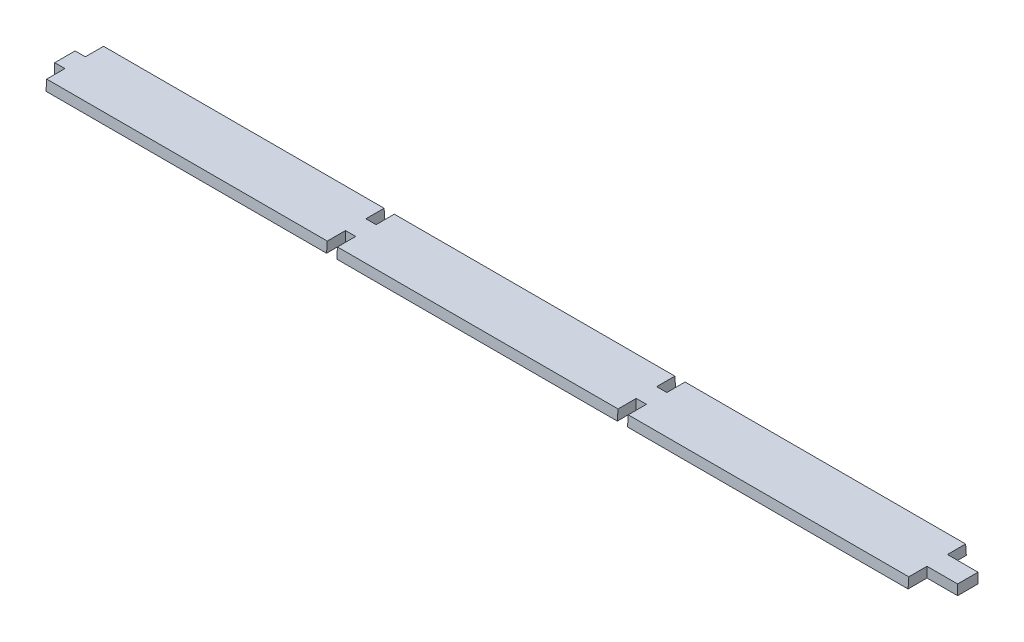
from build123d import *

# Parameters (mm, degrees)
EXTRUDE_1_DEPTH     = 2
EXTRUDE_START       = -173
EXTRUDE_3_DEPTH     = 171
CUT_EXTRUDE_START   = -173
CUT_EXTRUDE_2_DEPTH = 173
CUT_EXTRUDE_3_DEPTH = 173
SKETCH_4_W          = 2
SKETCH_4_H          = 6.981331277
SKETCH_4_H_2        = 7.769959708
CUT_EXTRUDE_4_DEPTH = 173
SKETCH_5_W          = 4
SKETCH_5_H          = 4
EXTRUDE_4_DEPTH     = 2


# Read off the part's stored shape, not the designer's step: 凸台-拉伸3, 切除-拉伸2
with BuildPart() as part:
    # 草图1 → 凸台-拉伸1 (new body)
    with BuildSketch(Plane(origin=(0, 0, 0), x_dir=(0, 0, -1), z_dir=(1, 0, 0))):
        with BuildLine():
            add(Edge.make_bspline(
                [(0, 193), (-0.012288284, 193), (-0.036860363, 192.682209119), (-0.073603598, 192.460340025), (-0.134145604, 191.982517083), (-0.216837903, 191.357126895), (-0.320148772, 190.531582795), (-0.442734222, 189.535054466), (-0.583708338, 188.359470773), (-0.741224015, 187.007350916), (-0.91342743, 185.485486569), (-1.098367032, 183.794042277), (-1.295153474, 181.932788993), (-1.503001463, 179.912860559), (-1.722142684, 177.734330299), (-1.951645546, 175.397073133), (-2.189862364, 172.914023799), (-2.436037979, 170.28517003), (-2.689763937, 167.510432908), (-2.949769263, 164.606175429), (-3.216039401, 161.572442464), (-3.488047586, 158.409161795), (-3.764070677, 155.134176566), (-4.043757612, 151.747511152), (-4.326255141, 148.249059823), (-4.609441768, 144.658859051), (-4.892481807, 140.976882583), (-5.174863501, 137.20308085), (-5.454691966, 133.359174667), (-5.731636208, 129.445182711), (-6.004663443, 125.461027301), (-6.271447257, 121.429287101), (-6.531172087, 117.349948117), (-6.782917884, 113.222962102), (-7.024648371, 109.072183193), (-7.255701434, 104.897612739), (-7.474940032, 100.699220215), (-7.679991999, 96.500812992), (-7.870083896, 92.302403851), (-8.044216273, 88.103993125), (-8.200659206, 83.929344542), (-8.338917914, 79.778489584), (-8.457541038, 75.651485195), (-8.538807898, 72.228525811), (-8.592437236, 69.509703707), (-8.626639137, 67.495423053), (-8.65491323, 65.495919754), (-8.677150684, 63.511211116), (-8.693364484, 61.541315238), (-8.703342087, 59.588985896), (-8.707094981, 57.65423498), (-8.70416559, 55.737088716), (-8.694147501, 53.840077973), (-8.676636137, 51.963218651), (-8.652114277, 50.106548117), (-8.620905719, 48.272790784), (-8.583512891, 46.461970379), (-8.539492523, 44.674120145), (-8.488374712, 42.911972119), (-8.429886653, 41.175558617), (-8.364375531, 39.464915618), (-8.291893829, 37.782113513), (-8.212897106, 36.127162371), (-8.127038802, 34.500129191), (-8.034038273, 32.903290152), (-7.933854661, 31.336686835), (-7.826611275, 29.800367448), (-7.712449105, 28.296372863), (-7.591658572, 26.824726145), (-7.4640673, 25.385515918), (-7.329411875, 23.980771462), (-7.187764067, 22.610559791), (-7.039458689, 21.274927209), (-6.884625469, 19.975944864), (-6.723768994, 18.713621105), (-6.557419856, 17.487989507), (-6.385750528, 16.300272749), (-6.209456896, 15.150457547), (-6.028620184, 14.038630129), (-5.842946286, 12.966402663), (-5.653007841, 11.933787905), (-5.458792398, 10.940905593), (-5.259967948, 9.989173646), (-5.057199181, 9.078608267), (-4.84951644, 8.209636835), (-4.635268995, 7.382464783), (-4.414704057, 6.597361178), (-4.187298343, 5.854834196), (-3.951488141, 5.1553355), (-3.708306212, 4.499219664), (-3.457504838, 3.88735236), (-3.196526443, 3.319048044), (-2.927146299, 2.794798361), (-2.650818291, 2.315014682), (-2.367000425, 1.880667992), (-2.0794803, 1.491615537), (-1.792593552, 1.14703863), (-1.50916051, 0.848541142), (-1.234038339, 0.5935698), (-0.966592418, 0.382804324), (-0.705813073, 0.218534665), (-0.459755647, 0.097332853), (-0.234428055, 0.020960156), (0, -0.01036), (0.234428055, 0.020960156), (0.459755647, 0.097332853), (0.705813073, 0.218534665), (0.966592418, 0.382804324), (1.234038339, 0.5935698), (1.50916051, 0.848541142), (1.792593552, 1.14703863), (2.0794803, 1.491615537), (2.367000425, 1.880667992), (2.650818291, 2.315014682), (2.927146299, 2.794798361), (3.196526443, 3.319048044), (3.457504838, 3.88735236), (3.708306212, 4.499219664), (3.951488141, 5.1553355), (4.187298343, 5.854834196), (4.414704057, 6.597361178), (4.635268995, 7.382464783), (4.84951644, 8.209636835), (5.057199181, 9.078608267), (5.259967948, 9.989173646), (5.458792398, 10.940905593), (5.653007841, 11.933787905), (5.842946286, 12.966402663), (6.028620184, 14.038630129), (6.209456896, 15.150457547), (6.385750528, 16.300272749), (6.557419856, 17.487989507), (6.723768994, 18.713621105), (6.884625469, 19.975944864), (7.039458689, 21.274927209), (7.187764067, 22.610559791), (7.329411875, 23.980771462), (7.4640673, 25.385515918), (7.591658572, 26.824726145), (7.712449105, 28.296372863), (7.826611275, 29.800367448), (7.933854661, 31.336686835), (8.034038273, 32.903290152), (8.127038802, 34.500129191), (8.212897106, 36.127162371), (8.291893829, 37.782113513), (8.364375531, 39.464915618), (8.429886653, 41.175558617), (8.488374712, 42.911972119), (8.539492523, 44.674120145), (8.583512891, 46.461970379), (8.620905719, 48.272790784), (8.652114277, 50.106548117), (8.676636137, 51.963218651), (8.694147501, 53.840077973), (8.70416559, 55.737088716), (8.707094981, 57.65423498), (8.703342087, 59.588985896), (8.693364484, 61.541315238), (8.677150684, 63.511211116), (8.65491323, 65.495919754), (8.626639137, 67.495423053), (8.592437236, 69.509703707), (8.538807898, 72.228525811), (8.457541038, 75.651485195), (8.338917914, 79.778489584), (8.200659206, 83.929344542), (8.044216273, 88.103993125), (7.870083896, 92.302403851), (7.679991999, 96.500812992), (7.474940032, 100.699220215), (7.255701434, 104.897612739), (7.024648371, 109.072183193), (6.782917884, 113.222962102), (6.531172087, 117.349948117), (6.271447257, 121.429287101), (6.004663443, 125.461027301), (5.731636208, 129.445182711), (5.454691966, 133.359174667), (5.174863501, 137.20308085), (4.892481807, 140.976882583), (4.609441768, 144.658859051), (4.326255141, 148.249059823), (4.043757612, 151.747511152), (3.764070677, 155.134176566), (3.488047586, 158.409161795), (3.216039401, 161.572442464), (2.949769263, 164.606175429), (2.689763937, 167.510432908), (2.436037979, 170.28517003), (2.189862364, 172.914023799), (1.951645546, 175.397073133), (1.722142684, 177.734330299), (1.503001463, 179.912860559), (1.295153474, 181.932788993), (1.098367032, 183.794042277), (0.91342743, 185.485486569), (0.741224015, 187.007350916), (0.583708338, 188.359470773), (0.442734222, 189.535054466), (0.320148772, 190.531582795), (0.216837903, 191.357126895), (0.134145604, 191.982517083), (0.073603598, 192.460340025), (0.036860363, 192.682209119), (0.012288284, 193), (0, 193)],
                knots=[0, 0, 0, 0, 0.000711186, 0.001422112, 0.002133252, 0.004251581, 0.006369198, 0.008487526, 0.011973078, 0.015457521, 0.018943038, 0.023734754, 0.028524887, 0.033316573, 0.039329174, 0.045339833, 0.051352399, 0.058485874, 0.06561704, 0.072750533, 0.080878992, 0.089004858, 0.097133325, 0.106119171, 0.115102078, 0.124087938, 0.133776582, 0.143462084, 0.153150736, 0.163374861, 0.173595632, 0.183819726, 0.194405238, 0.20498727, 0.215572756, 0.226336088, 0.237095883, 0.247859171, 0.25861711, 0.269371511, 0.28012949, 0.290699718, 0.301266554, 0.311836761, 0.316994414, 0.322150426, 0.327308111, 0.332351582, 0.337393397, 0.342436877, 0.347345125, 0.352251772, 0.357160037, 0.361913828, 0.366666143, 0.371419983, 0.375998605, 0.380575696, 0.385154319, 0.389537078, 0.393918407, 0.398301185, 0.402472485, 0.406642416, 0.410813696, 0.4147565, 0.418698025, 0.422640862, 0.426339932, 0.430037815, 0.433736878, 0.437177346, 0.44061666, 0.444057116, 0.447223686, 0.450389262, 0.45355583, 0.4564397, 0.459322619, 0.462206438, 0.464796512, 0.467385721, 0.469975829, 0.472263129, 0.474549689, 0.476836911, 0.478824757, 0.480812048, 0.482800105, 0.484492893, 0.486185006, 0.487877314, 0.489293868, 0.490710107, 0.49212745, 0.493276037, 0.494423523, 0.495568649, 0.496434714, 0.497302284, 0.498179926, 0.498796407, 0.499405099, 0.5, 0.500594901, 0.501203593, 0.501820074, 0.502697716, 0.503565286, 0.504431351, 0.505576477, 0.506723963, 0.50787255, 0.509289893, 0.510706132, 0.512122686, 0.513814994, 0.515507107, 0.517199895, 0.519187952, 0.521175243, 0.523163089, 0.525450311, 0.527736871, 0.530024171, 0.532614279, 0.535203488, 0.537793562, 0.540677381, 0.5435603, 0.54644417, 0.549610738, 0.552776314, 0.555942884, 0.55938334, 0.562822654, 0.566263122, 0.569962185, 0.573660068, 0.577359138, 0.581301975, 0.5852435, 0.589186304, 0.593357584, 0.597527515, 0.601698815, 0.606081593, 0.610462922, 0.614845681, 0.619424304, 0.624001395, 0.628580017, 0.633333857, 0.638086172, 0.642839963, 0.647748228, 0.652654875, 0.657563123, 0.662606603, 0.667648418, 0.672691889, 0.677849574, 0.683005586, 0.688163239, 0.698733446, 0.709300282, 0.71987051, 0.730628489, 0.74138289, 0.752140829, 0.762904117, 0.773663912, 0.784427244, 0.79501273, 0.805594762, 0.816180274, 0.826404368, 0.836625139, 0.846849264, 0.856537916, 0.866223418, 0.875912062, 0.884897922, 0.893880829, 0.902866675, 0.910995142, 0.919121008, 0.927249467, 0.93438296, 0.941514126, 0.948647601, 0.954660167, 0.960670826, 0.966683427, 0.971475113, 0.976265246, 0.981056962, 0.984542479, 0.988026922, 0.991512474, 0.993630802, 0.995748419, 0.997866748, 0.998577888, 0.999288814, 1, 1, 1, 1], degree=3))
        make_face()
    extrude(amount=EXTRUDE_1_DEPTH)

    # 凸台-拉伸3 outline → 凸台-拉伸3 (add)
    with BuildSketch(Plane(origin=(2, 0, 0), x_dir=(0, 0, -1), z_dir=(1, 0, 0)).offset(EXTRUDE_START)):
        with BuildLine():
            add(Edge.make_bspline(
                [(0, 193), (-0.012288284, 193), (-0.036860363, 192.682209119), (-0.073603598, 192.460340025), (-0.134145604, 191.982517083), (-0.216837903, 191.357126895), (-0.320148772, 190.531582795), (-0.442734222, 189.535054466), (-0.583708338, 188.359470773), (-0.741224015, 187.007350916), (-0.91342743, 185.485486569), (-1.098367032, 183.794042277), (-1.295153474, 181.932788993), (-1.503001463, 179.912860559), (-1.722142684, 177.734330299), (-1.951645546, 175.397073133), (-2.189862364, 172.914023799), (-2.436037979, 170.28517003), (-2.689763937, 167.510432908), (-2.949769263, 164.606175429), (-3.216039401, 161.572442464), (-3.488047586, 158.409161795), (-3.764070677, 155.134176566), (-4.043757612, 151.747511152), (-4.326255141, 148.249059823), (-4.609441768, 144.658859051), (-4.892481807, 140.976882583), (-5.174863501, 137.20308085), (-5.454691966, 133.359174667), (-5.731636208, 129.445182711), (-6.004663443, 125.461027301), (-6.271447257, 121.429287101), (-6.531172087, 117.349948117), (-6.782917884, 113.222962102), (-7.024648371, 109.072183193), (-7.255701434, 104.897612739), (-7.474940032, 100.699220215), (-7.679991999, 96.500812992), (-7.870083896, 92.302403851), (-8.044216273, 88.103993125), (-8.200659206, 83.929344542), (-8.338917914, 79.778489584), (-8.457541038, 75.651485195), (-8.538807898, 72.228525811), (-8.592437236, 69.509703707), (-8.626639137, 67.495423053), (-8.65491323, 65.495919754), (-8.677150684, 63.511211116), (-8.693364484, 61.541315238), (-8.703342087, 59.588985896), (-8.707094981, 57.65423498), (-8.70416559, 55.737088716), (-8.694147501, 53.840077973), (-8.676636137, 51.963218651), (-8.652114277, 50.106548117), (-8.620905719, 48.272790784), (-8.583512891, 46.461970379), (-8.539492523, 44.674120145), (-8.488374712, 42.911972119), (-8.429886653, 41.175558617), (-8.364375531, 39.464915618), (-8.291893829, 37.782113513), (-8.212897106, 36.127162371), (-8.127038802, 34.500129191), (-8.034038273, 32.903290152), (-7.933854661, 31.336686835), (-7.826611275, 29.800367448), (-7.712449105, 28.296372863), (-7.591658572, 26.824726145), (-7.4640673, 25.385515918), (-7.329411875, 23.980771462), (-7.187764067, 22.610559791), (-7.039458689, 21.274927209), (-6.884625469, 19.975944864), (-6.723768994, 18.713621105), (-6.557419856, 17.487989507), (-6.385750528, 16.300272749), (-6.209456896, 15.150457547), (-6.028620184, 14.038630129), (-5.842946286, 12.966402663), (-5.653007841, 11.933787905), (-5.458792398, 10.940905593), (-5.259967948, 9.989173646), (-5.057199181, 9.078608267), (-4.84951644, 8.209636835), (-4.635268995, 7.382464783), (-4.414704057, 6.597361178), (-4.187298343, 5.854834196), (-3.951488141, 5.1553355), (-3.708306212, 4.499219664), (-3.457504838, 3.88735236), (-3.196526443, 3.319048044), (-2.927146299, 2.794798361), (-2.650818291, 2.315014682), (-2.367000425, 1.880667992), (-2.0794803, 1.491615537), (-1.792593552, 1.14703863), (-1.50916051, 0.848541142), (-1.234038339, 0.5935698), (-0.966592418, 0.382804324), (-0.705813073, 0.218534665), (-0.459755647, 0.097332853), (-0.234428055, 0.020960156), (0, -0.01036), (0.234428055, 0.020960156), (0.459755647, 0.097332853), (0.705813073, 0.218534665), (0.966592418, 0.382804324), (1.234038339, 0.5935698), (1.50916051, 0.848541142), (1.792593552, 1.14703863), (2.0794803, 1.491615537), (2.367000425, 1.880667992), (2.650818291, 2.315014682), (2.927146299, 2.794798361), (3.196526443, 3.319048044), (3.457504838, 3.88735236), (3.708306212, 4.499219664), (3.951488141, 5.1553355), (4.187298343, 5.854834196), (4.414704057, 6.597361178), (4.635268995, 7.382464783), (4.84951644, 8.209636835), (5.057199181, 9.078608267), (5.259967948, 9.989173646), (5.458792398, 10.940905593), (5.653007841, 11.933787905), (5.842946286, 12.966402663), (6.028620184, 14.038630129), (6.209456896, 15.150457547), (6.385750528, 16.300272749), (6.557419856, 17.487989507), (6.723768994, 18.713621105), (6.884625469, 19.975944864), (7.039458689, 21.274927209), (7.187764067, 22.610559791), (7.329411875, 23.980771462), (7.4640673, 25.385515918), (7.591658572, 26.824726145), (7.712449105, 28.296372863), (7.826611275, 29.800367448), (7.933854661, 31.336686835), (8.034038273, 32.903290152), (8.127038802, 34.500129191), (8.212897106, 36.127162371), (8.291893829, 37.782113513), (8.364375531, 39.464915618), (8.429886653, 41.175558617), (8.488374712, 42.911972119), (8.539492523, 44.674120145), (8.583512891, 46.461970379), (8.620905719, 48.272790784), (8.652114277, 50.106548117), (8.676636137, 51.963218651), (8.694147501, 53.840077973), (8.70416559, 55.737088716), (8.707094981, 57.65423498), (8.703342087, 59.588985896), (8.693364484, 61.541315238), (8.677150684, 63.511211116), (8.65491323, 65.495919754), (8.626639137, 67.495423053), (8.592437236, 69.509703707), (8.538807898, 72.228525811), (8.457541038, 75.651485195), (8.338917914, 79.778489584), (8.200659206, 83.929344542), (8.044216273, 88.103993125), (7.870083896, 92.302403851), (7.679991999, 96.500812992), (7.474940032, 100.699220215), (7.255701434, 104.897612739), (7.024648371, 109.072183193), (6.782917884, 113.222962102), (6.531172087, 117.349948117), (6.271447257, 121.429287101), (6.004663443, 125.461027301), (5.731636208, 129.445182711), (5.454691966, 133.359174667), (5.174863501, 137.20308085), (4.892481807, 140.976882583), (4.609441768, 144.658859051), (4.326255141, 148.249059823), (4.043757612, 151.747511152), (3.764070677, 155.134176566), (3.488047586, 158.409161795), (3.216039401, 161.572442464), (2.949769263, 164.606175429), (2.689763937, 167.510432908), (2.436037979, 170.28517003), (2.189862364, 172.914023799), (1.951645546, 175.397073133), (1.722142684, 177.734330299), (1.503001463, 179.912860559), (1.295153474, 181.932788993), (1.098367032, 183.794042277), (0.91342743, 185.485486569), (0.741224015, 187.007350916), (0.583708338, 188.359470773), (0.442734222, 189.535054466), (0.320148772, 190.531582795), (0.216837903, 191.357126895), (0.134145604, 191.982517083), (0.073603598, 192.460340025), (0.036860363, 192.682209119), (0.012288284, 193), (0, 193)],
                knots=[0, 0, 0, 0, 0.000711186, 0.001422112, 0.002133252, 0.004251581, 0.006369198, 0.008487526, 0.011973078, 0.015457521, 0.018943038, 0.023734754, 0.028524887, 0.033316573, 0.039329174, 0.045339833, 0.051352399, 0.058485874, 0.06561704, 0.072750533, 0.080878992, 0.089004858, 0.097133325, 0.106119171, 0.115102078, 0.124087938, 0.133776582, 0.143462084, 0.153150736, 0.163374861, 0.173595632, 0.183819726, 0.194405238, 0.20498727, 0.215572756, 0.226336088, 0.237095883, 0.247859171, 0.25861711, 0.269371511, 0.28012949, 0.290699718, 0.301266554, 0.311836761, 0.316994414, 0.322150426, 0.327308111, 0.332351582, 0.337393397, 0.342436877, 0.347345125, 0.352251772, 0.357160037, 0.361913828, 0.366666143, 0.371419983, 0.375998605, 0.380575696, 0.385154319, 0.389537078, 0.393918407, 0.398301185, 0.402472485, 0.406642416, 0.410813696, 0.4147565, 0.418698025, 0.422640862, 0.426339932, 0.430037815, 0.433736878, 0.437177346, 0.44061666, 0.444057116, 0.447223686, 0.450389262, 0.45355583, 0.4564397, 0.459322619, 0.462206438, 0.464796512, 0.467385721, 0.469975829, 0.472263129, 0.474549689, 0.476836911, 0.478824757, 0.480812048, 0.482800105, 0.484492893, 0.486185006, 0.487877314, 0.489293868, 0.490710107, 0.49212745, 0.493276037, 0.494423523, 0.495568649, 0.496434714, 0.497302284, 0.498179926, 0.498796407, 0.499405099, 0.5, 0.500594901, 0.501203593, 0.501820074, 0.502697716, 0.503565286, 0.504431351, 0.505576477, 0.506723963, 0.50787255, 0.509289893, 0.510706132, 0.512122686, 0.513814994, 0.515507107, 0.517199895, 0.519187952, 0.521175243, 0.523163089, 0.525450311, 0.527736871, 0.530024171, 0.532614279, 0.535203488, 0.537793562, 0.540677381, 0.5435603, 0.54644417, 0.549610738, 0.552776314, 0.555942884, 0.55938334, 0.562822654, 0.566263122, 0.569962185, 0.573660068, 0.577359138, 0.581301975, 0.5852435, 0.589186304, 0.593357584, 0.597527515, 0.601698815, 0.606081593, 0.610462922, 0.614845681, 0.619424304, 0.624001395, 0.628580017, 0.633333857, 0.638086172, 0.642839963, 0.647748228, 0.652654875, 0.657563123, 0.662606603, 0.667648418, 0.672691889, 0.677849574, 0.683005586, 0.688163239, 0.698733446, 0.709300282, 0.71987051, 0.730628489, 0.74138289, 0.752140829, 0.762904117, 0.773663912, 0.784427244, 0.79501273, 0.805594762, 0.816180274, 0.826404368, 0.836625139, 0.846849264, 0.856537916, 0.866223418, 0.875912062, 0.884897922, 0.893880829, 0.902866675, 0.910995142, 0.919121008, 0.927249467, 0.93438296, 0.941514126, 0.948647601, 0.954660167, 0.960670826, 0.966683427, 0.971475113, 0.976265246, 0.981056962, 0.984542479, 0.988026922, 0.991512474, 0.993630802, 0.995748419, 0.997866748, 0.998577888, 0.999288814, 1, 1, 1, 1], degree=3))
        make_face()
    extrude(amount=EXTRUDE_3_DEPTH)

    # 切除-拉伸2 outline → 切除-拉伸2 (cut)
    with BuildSketch(Plane(origin=(2, 0, 0), x_dir=(0, 0, -1), z_dir=(1, 0, 0)).offset(CUT_EXTRUDE_START)):
        with BuildLine():
            add(Edge.make_bspline(
                [(5.570547263, 131.716510892), (5.530087414, 132.287234714), (5.399572783, 134.116327682), (5.174863501, 137.20308085), (4.892481807, 140.976882583), (4.609441768, 144.658859051), (4.326255141, 148.249059823), (4.043757612, 151.747511152), (3.764070677, 155.134176566), (3.488047586, 158.409161795), (3.216039401, 161.572442464), (2.949769263, 164.606175429), (2.689763937, 167.510432908), (2.436037979, 170.28517003), (2.189862364, 172.914023799), (1.951645546, 175.397073133), (1.722142684, 177.734330299), (1.503001463, 179.912860559), (1.295153474, 181.932788993), (1.098367032, 183.794042277), (0.91342743, 185.485486569), (0.741224015, 187.007350916), (0.583708338, 188.359470773), (0.442734222, 189.535054466), (0.320148772, 190.531582795), (0.216837903, 191.357126895), (0.134145604, 191.982517083), (0.073603598, 192.460340025), (0.036860363, 192.682209119), (0, 193.158924466), (-0.036860363, 192.682209119), (-0.073603598, 192.460340025), (-0.134145604, 191.982517083), (-0.216837903, 191.357126895), (-0.320148772, 190.531582795), (-0.442734222, 189.535054466), (-0.583708338, 188.359470773), (-0.741224015, 187.007350916), (-0.91342743, 185.485486569), (-1.098367032, 183.794042277), (-1.295153474, 181.932788993), (-1.503001463, 179.912860559), (-1.722142684, 177.734330299), (-1.951645546, 175.397073133), (-2.189862364, 172.914023799), (-2.436037979, 170.28517003), (-2.689763937, 167.510432908), (-2.949769263, 164.606175429), (-3.216039401, 161.572442464), (-3.488047586, 158.409161795), (-3.764070677, 155.134176566), (-4.043757612, 151.747511152), (-4.326255141, 148.249059823), (-4.609441768, 144.658859051), (-4.892481807, 140.976882583), (-5.174863501, 137.20308085), (-5.399572783, 134.116327682), (-5.530087414, 132.287234714), (-5.570547263, 131.716510892)],
                knots=[0.842455257, 0.842455257, 0.842455257, 0.842455257, 0.846849264, 0.856537916, 0.866223418, 0.875912062, 0.884897922, 0.893880829, 0.902866675, 0.910995142, 0.919121008, 0.927249467, 0.93438296, 0.941514126, 0.948647601, 0.954660167, 0.960670826, 0.966683427, 0.971475113, 0.976265246, 0.981056962, 0.984542479, 0.988026922, 0.991512474, 0.993630802, 0.995748419, 0.997866748, 0.998577888, 0.999288814, 1, 1.000711186, 1.001422112, 1.002133252, 1.004251581, 1.006369198, 1.008487526, 1.011973078, 1.015457521, 1.018943038, 1.023734754, 1.028524887, 1.033316573, 1.039329174, 1.045339833, 1.051352399, 1.058485874, 1.06561704, 1.072750533, 1.080878992, 1.089004858, 1.097133325, 1.106119171, 1.115102078, 1.124087938, 1.133776582, 1.143462084, 1.153150736, 1.157544743, 1.157544743, 1.157544743, 1.157544743], degree=3))
            Line((-5.570547263, 131.716510892), (5.570547263, 131.716510892))
        make_face()
    extrude(amount=CUT_EXTRUDE_2_DEPTH, mode=Mode.SUBTRACT)

    # 草图3 → 切除-拉伸3 (cut)
    with BuildSketch(Plane(origin=(2, 0, 0), x_dir=(0, 0, -1), z_dir=(1, 0, 0))):
        Polygon((-6.993573495, 129.716510892), (7.739459965, 129.716510892), (111.79619605, -19.885183991), (-79.231750755, -19.885183991), align=None)
    extrude(amount=-CUT_EXTRUDE_3_DEPTH, mode=Mode.SUBTRACT)

    # 草图4 → 切除-拉伸4 (cut)
    with BuildSketch(Plane(origin=(0, 131.716510892, 0), x_dir=(1, 0, 0), z_dir=(0, 1, 0))):
        with Locations((1, 5.490665639)):
            Rectangle(SKETCH_4_W, SKETCH_4_H)
        with Locations((1, -5.884979854)):
            Rectangle(SKETCH_4_W, SKETCH_4_H_2)
        with Locations((-56, 5.490665639)):
            Rectangle(SKETCH_4_W, SKETCH_4_H)
        with Locations((-56, -5.884979854)):
            Rectangle(SKETCH_4_W, SKETCH_4_H_2)
        with Locations((-113, 5.490665639)):
            Rectangle(SKETCH_4_W, SKETCH_4_H)
        with Locations((-113, -5.884979854)):
            Rectangle(SKETCH_4_W, SKETCH_4_H_2)
        with Locations((-170, 5.490665639)):
            Rectangle(SKETCH_4_W, SKETCH_4_H)
        with Locations((-170, -5.884979854)):
            Rectangle(SKETCH_4_W, SKETCH_4_H_2)
    extrude(amount=-CUT_EXTRUDE_4_DEPTH, mode=Mode.SUBTRACT)

    # 草图5 → 凸台-拉伸4 (add)
    with BuildSketch(Plane(origin=(0, 131.716510892, 0), x_dir=(1, 0, 0), z_dir=(0, 1, 0))):
        with Locations((4, 0)):
            Rectangle(SKETCH_5_W, SKETCH_5_H)
    extrude(amount=-EXTRUDE_4_DEPTH)


solid = part.part
